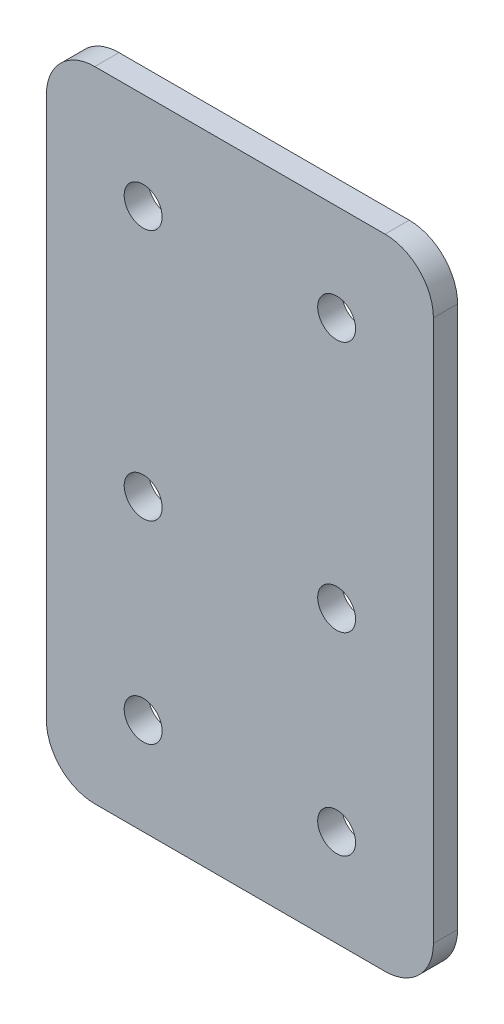
from build123d import *

# Parameters (mm, degrees)
SKETCH2_W           = 50.8
SKETCH2_H           = 83.82
BOSS_EXTRUDE1_DEPTH = 3.175
SKETCH3_R           = 2.4892
CUT_EXTRUDE1_DEPTH  = 99.063821183
FILLET1_R           = 6.35


with BuildPart() as part:
    # Sketch2 → Boss-Extrude1 (new body)
    with BuildSketch(Plane.XY):
        with Locations((25.4, 41.91)):
            Rectangle(SKETCH2_W, SKETCH2_H)
    extrude(amount=-BOSS_EXTRUDE1_DEPTH)

    # Sketch3 → Cut-Extrude1 (cut, through all)
    with BuildSketch(Plane.XY):
        with Locations((12.7, 71.12)):
            Circle(SKETCH3_R)
        with Locations((38.1, 71.12)):
            Circle(SKETCH3_R)
        with Locations((12.7, 38.1)):
            Circle(SKETCH3_R)
        with Locations((12.7, 12.7)):
            Circle(SKETCH3_R)
        with Locations((12.7, -12.7)):
            Circle(SKETCH3_R)
        with Locations((12.7, -38.1)):
            Circle(SKETCH3_R)
        with Locations((12.7, -63.5)):
            Circle(SKETCH3_R)
        with Locations((38.1, 12.7)):
            Circle(SKETCH3_R)
        with Locations((38.1, -12.7)):
            Circle(SKETCH3_R)
        with Locations((38.1, -38.1)):
            Circle(SKETCH3_R)
        with Locations((38.1, -63.5)):
            Circle(SKETCH3_R)
        with Locations((38.1, 38.1)):
            Circle(SKETCH3_R)
    extrude(amount=-CUT_EXTRUDE1_DEPTH, mode=Mode.SUBTRACT)

    # Fillet1
    fillet1_edges = [part.edges().sort_by_distance(p)[0] for p in [
        (0, 0, -1.5875),
        (0, 83.82, -1.5875),
        (50.8, 0, -1.5875),
        (50.8, 83.82, -1.5875),
    ]]
    fillet(fillet1_edges, radius=FILLET1_R)


solid = part.part
